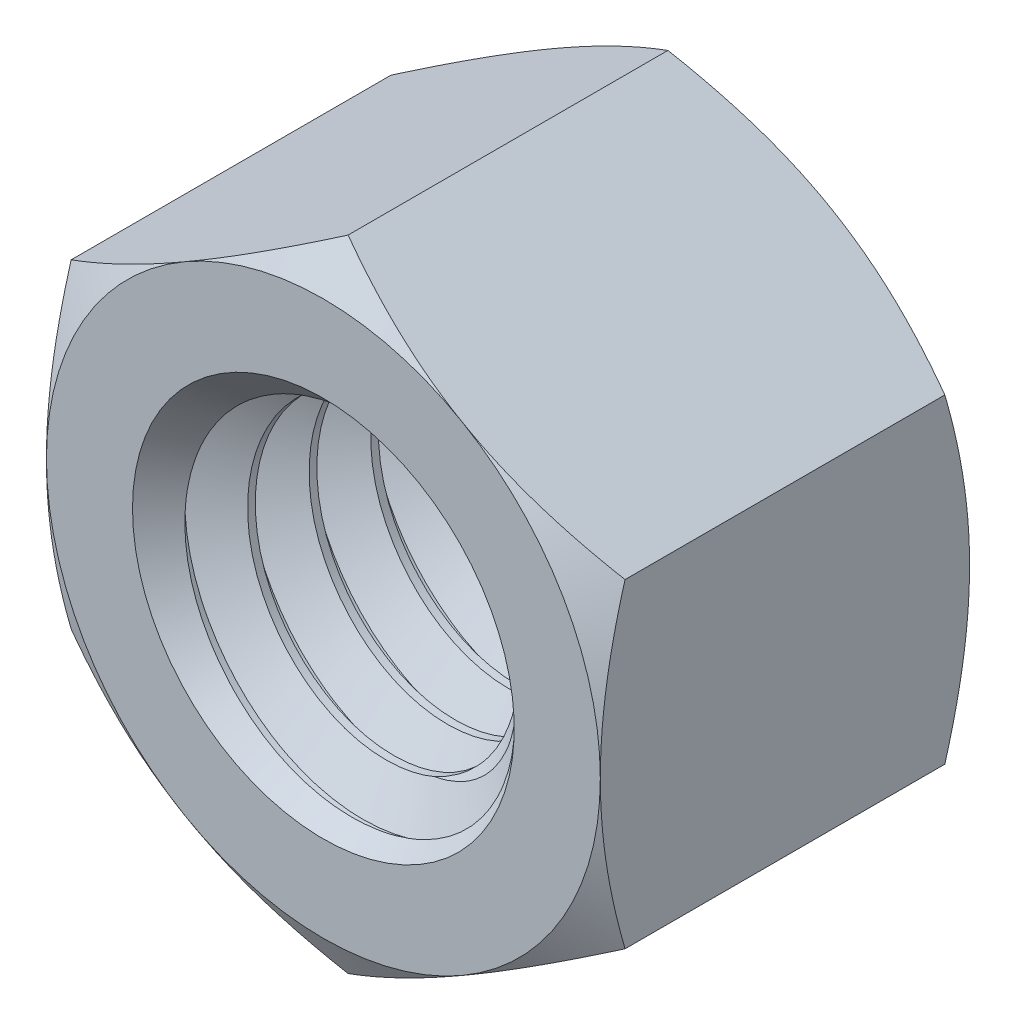
from build123d import *

# Parameters (mm, degrees)
EXTRUDE1_DEPTH          = 1.5
EXTRUDE1_DEPTH_BACK     = 1.5
SKETCH1_R               = 1.5
SWEEP1_PITCH            = 0.5
EXTRUDE2_DEPTH          = 5.905477972
SKETCH8_OUTSIDE_W       = 28.5
SKETCH8_OUTSIDE_H       = 29.196
SKETCH8_OUTSIDE_R       = 2.25
EXTRUDE4_DEPTH          = 5.905477972
EXTRUDE4_DRAFT          = -60
MIRROR1_COPY_1_SKETCH_W = 28.5
MIRROR1_COPY_1_SKETCH_H = 29.196
MIRROR1_COPY_1_SKETCH_R = 2.25
MIRROR1_COPY_1_DEPTH    = 5.905477972
MIRROR1_COPY_1_DRAFT    = -60


with BuildPart() as part:
    # Sketch1 → Extrude1 (new, two sides: drawn at the far end of the back side and taken through both)
    with BuildSketch(Plane.XY.offset(-EXTRUDE1_DEPTH_BACK)):
        Polygon((0, 2.598076211), (-2.25, 1.299038106), (-2.25, -1.299038106), (0, -2.598076211), (2.25, -1.299038106), (2.25, 1.299038106), align=None)
        Circle(SKETCH1_R, mode=Mode.SUBTRACT)
    extrude(amount=EXTRUDE1_DEPTH + EXTRUDE1_DEPTH_BACK)

    # Sweep1: the profile of Sketch12 profile screwed along a right-hand helix of 7 turns, 6 arcs to a turn; built about Z, then put on its axis
    sweep1_z = Axis((0, 0, 0), (0, 0, 1))
    sweep1_corners = [(1.5003, 0, -0.437673205), (1.5003, 0, 0.000173205), (1.175240474, 0, -0.1875), (1.175240474, 0, -0.25)]
    with BuildLine(mode=Mode.PRIVATE) as sweep1_profile:
        Line(sweep1_corners[0], sweep1_corners[1])
        Line(sweep1_corners[1], sweep1_corners[2])
        Line(sweep1_corners[2], sweep1_corners[3])
        Line(sweep1_corners[3], sweep1_corners[0])
    sweep1_cap = Face(sweep1_profile.wire())
    sweep1_turn_angles = [0, 30, 60, 90, 120, 150, 180, 210, 240, 270, 300, 330, 360]
    sweep1_turn_weights = [1, 0.8660254037844387, 1, 0.8660254037844387, 1, 0.8660254037844387, 1, 0.8660254037844387, 1, 0.8660254037844387, 1, 0.8660254037844387, 1]
    sweep1_turn_rails = [Edge.make_bspline([Vector(p[0], p[1], 0).rotate(sweep1_z, sweep1_turn_angles[k]) / sweep1_turn_weights[k] + Vector(0, 0, p[2] + SWEEP1_PITCH * sweep1_turn_angles[k] / 360) for k in range(13)], [0, 0, 0, 1, 1, 2, 2, 3, 3, 4, 4, 5, 5, 6, 6, 6], 2, sweep1_turn_weights) for p in sweep1_corners]
    sweep1_turn_sides = [Face.make_surface_from_curves(sweep1_turn_rails[p[0]], sweep1_turn_rails[p[1]]) for p in [(0, 1), (1, 2), (2, 3), (3, 0)]]
    sweep1 = Plane(origin=(0, 0, -1.5), x_dir=(0, 1, 0), z_dir=(0, 0, 1)) * Solid(Shell([*[p.moved(Location((0, 0, SWEEP1_PITCH * i))) for i in range(7) for p in sweep1_turn_sides], sweep1_cap, sweep1_cap.rotate(sweep1_z, 2520).moved(Location((0, 0, SWEEP1_PITCH * 2520 / 360)))]))
    add(sweep1)

    # Sketch6 → Extrude2 (cut, through all)
    with BuildSketch(Plane(origin=(0, 0, -1.5), x_dir=(-1, 0, 0), z_dir=(0, 0, -1))):
        Polygon((0, 2.598076211), (-2.25, 1.299038106), (-2.25, -1.299038106), (0, -2.598076211), (2.25, -1.299038106), (2.25, 1.299038106), align=None)
    extrude2 = extrude(amount=EXTRUDE2_DEPTH, mode=Mode.SUBTRACT)

    # Extrude3 cone 1 section (through the dimple's axis) → Extrude3 (revolve, cut)
    with BuildSketch(Plane(origin=(0, 0, -1.5), x_dir=(0, 1, 0), z_dir=(1, 0, 0))):
        Polygon((0, 0), (1.5508, 0), (0, 1.663029396), align=None)
    extrude3 = revolve(axis=Axis((0, 0, -1.5), (0, 0, 1)), mode=Mode.SUBTRACT)


with BuildPart() as extrude4_tool:
    # Sketch8 outside → Extrude4 (with draft: the straight prism first)
    with BuildSketch(Plane(origin=(0, 0, -1.5), x_dir=(-1, 0, 0), z_dir=(0, 0, -1))):
        Rectangle(SKETCH8_OUTSIDE_W, SKETCH8_OUTSIDE_H)
        Circle(SKETCH8_OUTSIDE_R, mode=Mode.SUBTRACT)
    extrude(amount=-EXTRUDE4_DEPTH)
    # Extrude4: the draft: its side faces are tilted about the plane it starts from
    extrude4_sides = [extrude4_tool.faces().sort_by_distance(p)[0] for p in [
        (0, -14.598, 1.452738986),
        (-14.25, 0, 1.452738986),
        (0, 14.598, 1.452738986),
        (14.25, 0, 1.452738986),
        (2.25, 0, 1.452738986),
    ]]
    draft(extrude4_sides, Plane(origin=(0, 0, -1.5), x_dir=(-1, 0, 0), z_dir=(0, 0, -1)), EXTRUDE4_DRAFT)


with BuildPart() as part_1:
    add(part.part)

    # Extrude4: cut by extrude4_tool
    add(extrude4_tool.part, mode=Mode.SUBTRACT)

    # Mirror1: Extrude2, Extrude3 across plane
    add(extrude2.mirror(Plane.XY), mode=Mode.SUBTRACT)
    add(extrude3.mirror(Plane.XY), mode=Mode.SUBTRACT)


with BuildPart() as mirror1_copy_1_tool:
    # Mirror1 copy 1 sketch → Mirror1 copy 1 (with draft: the straight prism first)
    with BuildSketch(Plane(origin=(0, 0, 1.5), x_dir=(-1, 0, 0), z_dir=(0, 0, 1))):
        Rectangle(MIRROR1_COPY_1_SKETCH_W, MIRROR1_COPY_1_SKETCH_H)
        Circle(MIRROR1_COPY_1_SKETCH_R, mode=Mode.SUBTRACT)
    extrude(amount=-MIRROR1_COPY_1_DEPTH)
    # Mirror1 copy 1: the draft: its side faces are tilted about the plane it starts from
    mirror1_copy_1_sides = [mirror1_copy_1_tool.faces().sort_by_distance(p)[0] for p in [
        (0, -14.598, -1.452738986),
        (-14.25, 0, -1.452738986),
        (0, 14.598, -1.452738986),
        (14.25, 0, -1.452738986),
        (2.25, 0, -1.452738986),
    ]]
    draft(mirror1_copy_1_sides, Plane(origin=(0, 0, 1.5), x_dir=(-1, 0, 0), z_dir=(0, 0, 1)), MIRROR1_COPY_1_DRAFT)


with BuildPart() as part_2:
    add(part_1.part)

    # Mirror1 copy 1: cut by mirror1_copy_1_tool
    add(mirror1_copy_1_tool.part, mode=Mode.SUBTRACT)


solid = part_2.part
